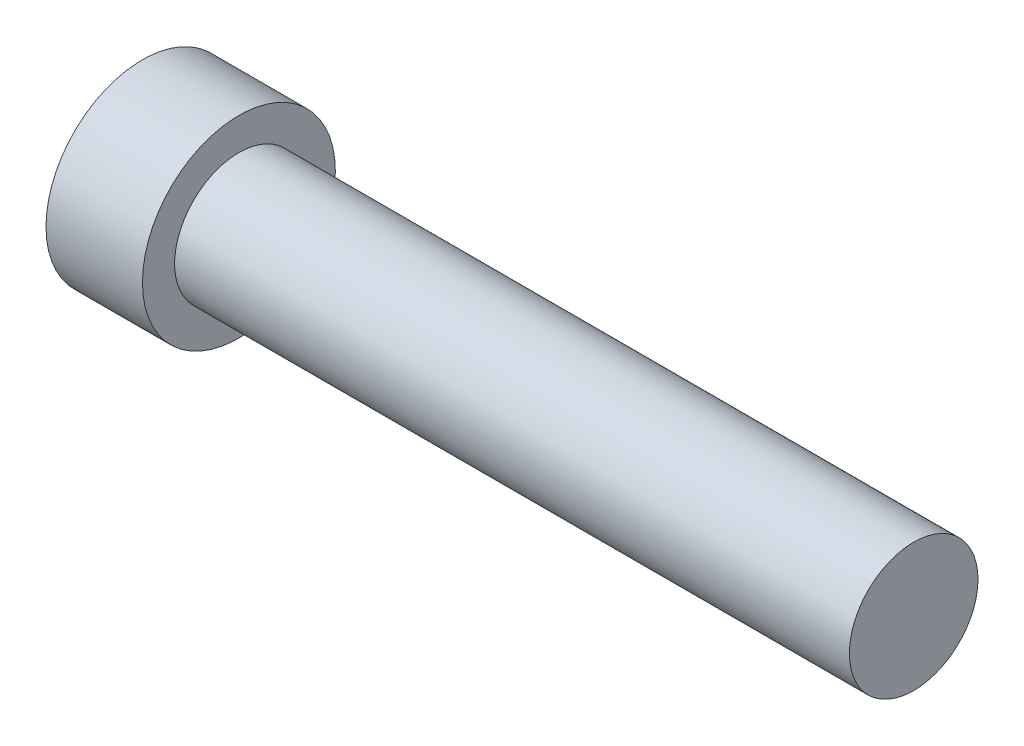
from build123d import *

# Parameters (mm, degrees)
SKETCH1_R           = 15
BOSS_EXTRUDE1_DEPTH = 15
SKETCH2_R           = 10
BOSS_EXTRUDE2_DEPTH = 104.94


with BuildPart() as part:
    # Sketch1 → Boss-Extrude1 (new body)
    with BuildSketch(Plane.YZ):
        Circle(SKETCH1_R)
    extrude(amount=BOSS_EXTRUDE1_DEPTH)

    # Sketch2 → Boss-Extrude2 (add)
    with BuildSketch(Plane.YZ.offset(15)):
        Circle(SKETCH2_R)
    extrude(amount=BOSS_EXTRUDE2_DEPTH)


solid = part.part
